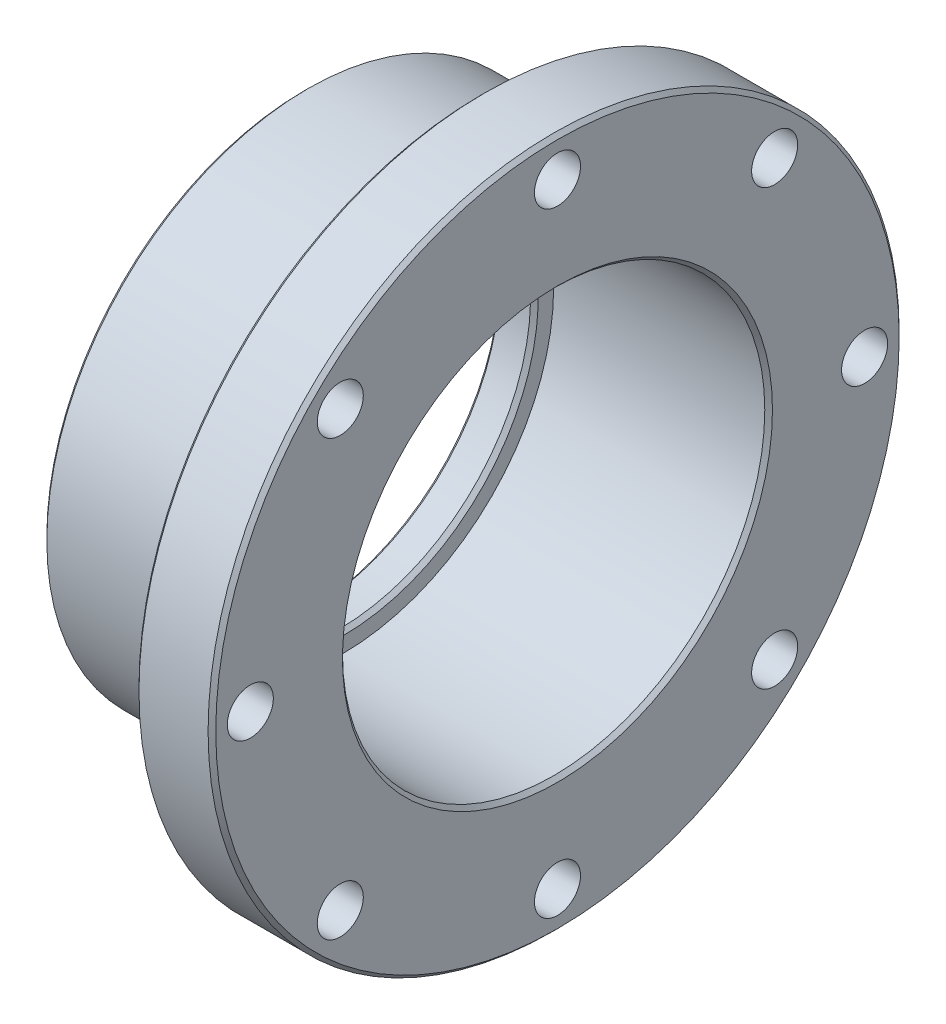
from build123d import *

# Parameters (mm, degrees)
CUT_EXTRUDE_1_REACH = 69.668
SKETCH_3_R          = 3
CHAMFER_1_SIZE      = 0.5


with BuildPart() as part:
    # 草图1 → 旋转1 (revolve)
    with BuildSketch(Plane.XY):
        Polygon((0, 0), (0, 34), (23, 34), (23, 45), (33, 45), (33, 0), align=None)
    revolve(axis=Axis((0, 0, 0), (-1, 0, 0)))

    # 草图2 → 切除-旋转1 (revolve, cut)
    with BuildSketch(Plane.XY):
        Polygon((0, 0), (0, 25), (5, 25), (5, 27.5), (33, 27.5), (33, 0), align=None)
    revolve(axis=Axis((0, 0, 0), (-1, 0, 0)), mode=Mode.SUBTRACT)

    # 草图3 → 切除-拉伸1 (cut, up to next)
    with BuildSketch(Plane.ZY.offset(-23), mode=Mode.PRIVATE) as cut_extrude_1_sk1:
        with Locations((0, 40)):
            Circle(SKETCH_3_R)
    cut_extrude_1_tool1 = extrude(cut_extrude_1_sk1.sketch, amount=-CUT_EXTRUDE_1_REACH, mode=Mode.PRIVATE) & part.part
    # 草图3 → 切除-拉伸1 (cut, up to next)
    with BuildSketch(Plane.ZY.offset(-23), mode=Mode.PRIVATE) as cut_extrude_1_sk2:
        with Locations((28.284271247, 28.284271247)):
            Circle(SKETCH_3_R)
    cut_extrude_1_tool2 = extrude(cut_extrude_1_sk2.sketch, amount=-CUT_EXTRUDE_1_REACH, mode=Mode.PRIVATE) & part.part
    # 草图3 → 切除-拉伸1 (cut, up to next)
    with BuildSketch(Plane.ZY.offset(-23), mode=Mode.PRIVATE) as cut_extrude_1_sk3:
        with Locations((40, 0)):
            Circle(SKETCH_3_R)
    cut_extrude_1_tool3 = extrude(cut_extrude_1_sk3.sketch, amount=-CUT_EXTRUDE_1_REACH, mode=Mode.PRIVATE) & part.part
    # 草图3 → 切除-拉伸1 (cut, up to next)
    with BuildSketch(Plane.ZY.offset(-23), mode=Mode.PRIVATE) as cut_extrude_1_sk4:
        with Locations((28.284271247, -28.284271247)):
            Circle(SKETCH_3_R)
    cut_extrude_1_tool4 = extrude(cut_extrude_1_sk4.sketch, amount=-CUT_EXTRUDE_1_REACH, mode=Mode.PRIVATE) & part.part
    # 草图3 → 切除-拉伸1 (cut, up to next)
    with BuildSketch(Plane.ZY.offset(-23), mode=Mode.PRIVATE) as cut_extrude_1_sk5:
        with Locations((0, -40)):
            Circle(SKETCH_3_R)
    cut_extrude_1_tool5 = extrude(cut_extrude_1_sk5.sketch, amount=-CUT_EXTRUDE_1_REACH, mode=Mode.PRIVATE) & part.part
    # 草图3 → 切除-拉伸1 (cut, up to next)
    with BuildSketch(Plane.ZY.offset(-23), mode=Mode.PRIVATE) as cut_extrude_1_sk6:
        with Locations((-28.284271247, -28.284271247)):
            Circle(SKETCH_3_R)
    cut_extrude_1_tool6 = extrude(cut_extrude_1_sk6.sketch, amount=-CUT_EXTRUDE_1_REACH, mode=Mode.PRIVATE) & part.part
    # 草图3 → 切除-拉伸1 (cut, up to next)
    with BuildSketch(Plane.ZY.offset(-23), mode=Mode.PRIVATE) as cut_extrude_1_sk7:
        with Locations((-40, 0)):
            Circle(SKETCH_3_R)
    cut_extrude_1_tool7 = extrude(cut_extrude_1_sk7.sketch, amount=-CUT_EXTRUDE_1_REACH, mode=Mode.PRIVATE) & part.part
    # 草图3 → 切除-拉伸1 (cut, up to next)
    with BuildSketch(Plane.ZY.offset(-23), mode=Mode.PRIVATE) as cut_extrude_1_sk8:
        with Locations((-28.284271247, 28.284271247)):
            Circle(SKETCH_3_R)
    cut_extrude_1_tool8 = extrude(cut_extrude_1_sk8.sketch, amount=-CUT_EXTRUDE_1_REACH, mode=Mode.PRIVATE) & part.part
    add(cut_extrude_1_tool1.solids().sort_by_distance((23, 40, 0))[0], mode=Mode.SUBTRACT)
    add(cut_extrude_1_tool2.solids().sort_by_distance((23, 28.284271, 28.284271))[0], mode=Mode.SUBTRACT)
    add(cut_extrude_1_tool3.solids().sort_by_distance((23, 0, 40))[0], mode=Mode.SUBTRACT)
    add(cut_extrude_1_tool4.solids().sort_by_distance((23, -28.284271, 28.284271))[0], mode=Mode.SUBTRACT)
    add(cut_extrude_1_tool5.solids().sort_by_distance((23, -40, 0))[0], mode=Mode.SUBTRACT)
    add(cut_extrude_1_tool6.solids().sort_by_distance((23, -28.284271, -28.284271))[0], mode=Mode.SUBTRACT)
    add(cut_extrude_1_tool7.solids().sort_by_distance((23, 0, -40))[0], mode=Mode.SUBTRACT)
    add(cut_extrude_1_tool8.solids().sort_by_distance((23, 28.284271, -28.284271))[0], mode=Mode.SUBTRACT)

    # 倒角1
    chamfer_1_edges = [part.edges().sort_by_distance(p)[0] for p in [
        (5, -25, 0),
        (33, -27.5, 0),
        (33, -45, 0),
        (23, -45, 0),
        (0, -34, 0),
        (0, -25, 0),
    ]]
    chamfer(chamfer_1_edges, length=CHAMFER_1_SIZE)


solid = part.part
